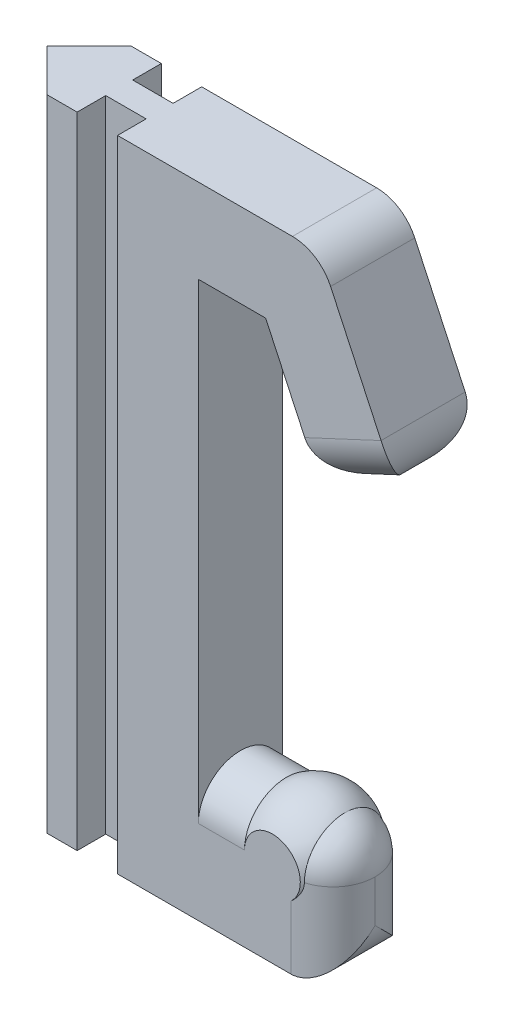
from build123d import *

# Parameters (mm, degrees)
EXTRUDE_1_DEPTH     = 5
FILLET_1_R          = 2.5
EXTRUDE_2_DEPTH     = 8
FILLET_3_R          = 2.5
SKETCH_5_W          = 1.467751534
SKETCH_5_H          = 4.178210798
SKETCH_5_W_2        = 1.389566385
CUT_EXTRUDE_1_DEPTH = 20
EXTRUDE_3_DEPTH     = 38
SKETCH_7_W          = 2.4
SKETCH_7_H          = 1.7
CUT_EXTRUDE_2_DEPTH = 38


with BuildPart() as part:
    # 草图1 → 凸台-拉伸1 (new body)
    with BuildSketch(Plane.XY):
        Polygon((0, 0), (0, 28), (4, 28), (7.380946094, 20.749537704), (11.912485029, 22.862629012), (7.185351304, 33), (-5, 33), (-5, -5), (8, -5), (8, 0), align=None)
    extrude(amount=EXTRUDE_1_DEPTH)

    # 圆角1
    fillet_1_edges = [part.edges().sort_by_distance(p)[0] for p in [
        (9.646715562, 21.806083358, 0),
        (7.185351304, 33, 2.5),
        (11.912485029, 22.862629012, 2.5),
        (7.380946094, 20.749537704, 2.5),
        (9.646715562, 21.806083358, 5),
    ]]
    fillet(fillet_1_edges, radius=FILLET_1_R - 0.0001)  # a hair under: the kernel refuses the full size

    # 草图3 → 凸台-拉伸2 (add)
    with BuildSketch(Plane(origin=(0, 0, 0), x_dir=(0, 0, -1), z_dir=(1, 0, 0))):
        with BuildLine():
            Line((-5, 0), (0, 0))
            ThreePointArc((0, 0), (-2.5, 2.5), (-5, 0))
        make_face()
    extrude(amount=EXTRUDE_2_DEPTH)

    # 圆角3
    fillet_3_edges = [part.edges().sort_by_distance(p)[0] for p in [
        (8, -2.5, 0),
        (8, -5, 2.5),
        (8, -2.5, 5),
        (8, 2.5, 2.5),
    ]]
    fillet(fillet_3_edges, radius=FILLET_3_R - 0.0001)  # a hair under: the kernel refuses the full size

    # 草图4 → 旋转3 (revolve)
    with BuildSketch(Plane(origin=(4.4, 0, 0), x_dir=(0, 0, -1), z_dir=(1, 0, 0))):
        with BuildLine():
            Line((-5.5, 0), (0.5, 0))
            ThreePointArc((0.5, 0), (-2.5, 3), (-5.5, 0))
        make_face()
    revolve(axis=Axis((4.4, 0, 2.5), (0, 0, -1)))

    # 草图5 → 切除-拉伸1 (cut)
    with BuildSketch(Plane.ZY.offset(5)):
        with Locations((-0.733875767, -0.010051234)):
            Rectangle(SKETCH_5_W, SKETCH_5_H)
        with Locations((5.694783193, -0.010051234)):
            Rectangle(SKETCH_5_W_2, SKETCH_5_H)
    extrude(amount=-CUT_EXTRUDE_1_DEPTH, mode=Mode.SUBTRACT)

    # 草图6 → 凸台-拉伸3 (add)
    with BuildSketch(Plane.XZ.offset(5)):
        Polygon((-5, 2.5), (-5, 3.5), (-7, 3.5), (-7, 5), (-9, 5), (-11.5, 2.5), (-9, 0), (-7, 0), (-7, 1.5), (-5, 1.5), align=None)
    extrude(amount=-EXTRUDE_3_DEPTH)

    # 草图7 → 切除-拉伸2 (cut)
    with BuildSketch(Plane.XZ.offset(5)):
        with Locations((-6, 4.15)):
            Rectangle(SKETCH_7_W, SKETCH_7_H)
        with Locations((-6, 0.85)):
            Rectangle(SKETCH_7_W, SKETCH_7_H)
    extrude(amount=-CUT_EXTRUDE_2_DEPTH, mode=Mode.SUBTRACT)


solid = part.part
